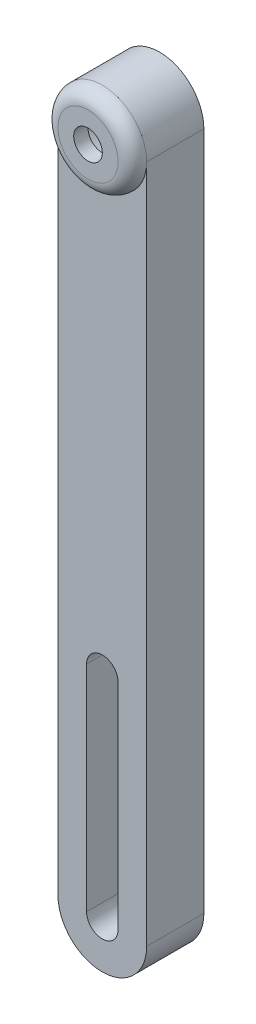
from build123d import *

# Parameters (mm, degrees)
SKETCH1_R           = 2.5
BOSS_EXTRUDE1_DEPTH = 4
SKETCH2_R           = 3.1
SKETCH2_R_2         = 1
BOSS_EXTRUDE2_DEPTH = 1
FILLET1_R           = 1


with BuildPart() as part:
    # Sketch1 → Boss-Extrude1 (new body)
    with BuildSketch(Plane.XY):
        with BuildLine():
            Line((-5.677617002, 7.123043478), (-5.677617002, -40.376956522))
            ThreePointArc((-5.677617002, -40.376956522), (-8.777617002, -43.476956522), (-11.877617002, -40.376956522))
            Line((-11.877617002, -40.376956522), (-11.877617002, 7.123043478))
            ThreePointArc((-11.877617002, 7.123043478), (-8.777617002, 10.223043478), (-5.677617002, 7.123043478))
        make_face()
        with Locations((-8.777617002, 7.123043478)):
            Circle(SKETCH1_R, mode=Mode.SUBTRACT)
        with BuildLine():
            Line((-7.677617002, -25.376956522), (-7.677617002, -40.376956522))
            ThreePointArc((-7.677617002, -40.376956522), (-8.777617002, -41.476956522), (-9.877617002, -40.376956522))
            Line((-9.877617002, -40.376956522), (-9.877617002, -25.376956522))
            ThreePointArc((-9.877617002, -25.376956522), (-8.777617002, -24.276956522), (-7.677617002, -25.376956522))
        make_face(mode=Mode.SUBTRACT)
    extrude(amount=BOSS_EXTRUDE1_DEPTH)


with BuildPart() as body_2:
    # Sketch2 → Boss-Extrude2 (new body)
    with BuildSketch(Plane.XY.offset(4)):
        with Locations((-8.777617002, 7.123043478)):
            Circle(SKETCH2_R)
        with Locations((-8.777617002, 7.123043478)):
            Circle(SKETCH2_R_2, mode=Mode.SUBTRACT)
    extrude(amount=BOSS_EXTRUDE2_DEPTH)

    # Fillet1
    fillet1_edges = [body_2.edges().sort_by_distance(p)[0] for p in [
        (-11.877617002, 7.123043478, 5),
    ]]
    fillet(fillet1_edges, radius=FILLET1_R - 0.0001)  # a hair under: the kernel refuses the full size


solid = Compound([part.part, body_2.part])
